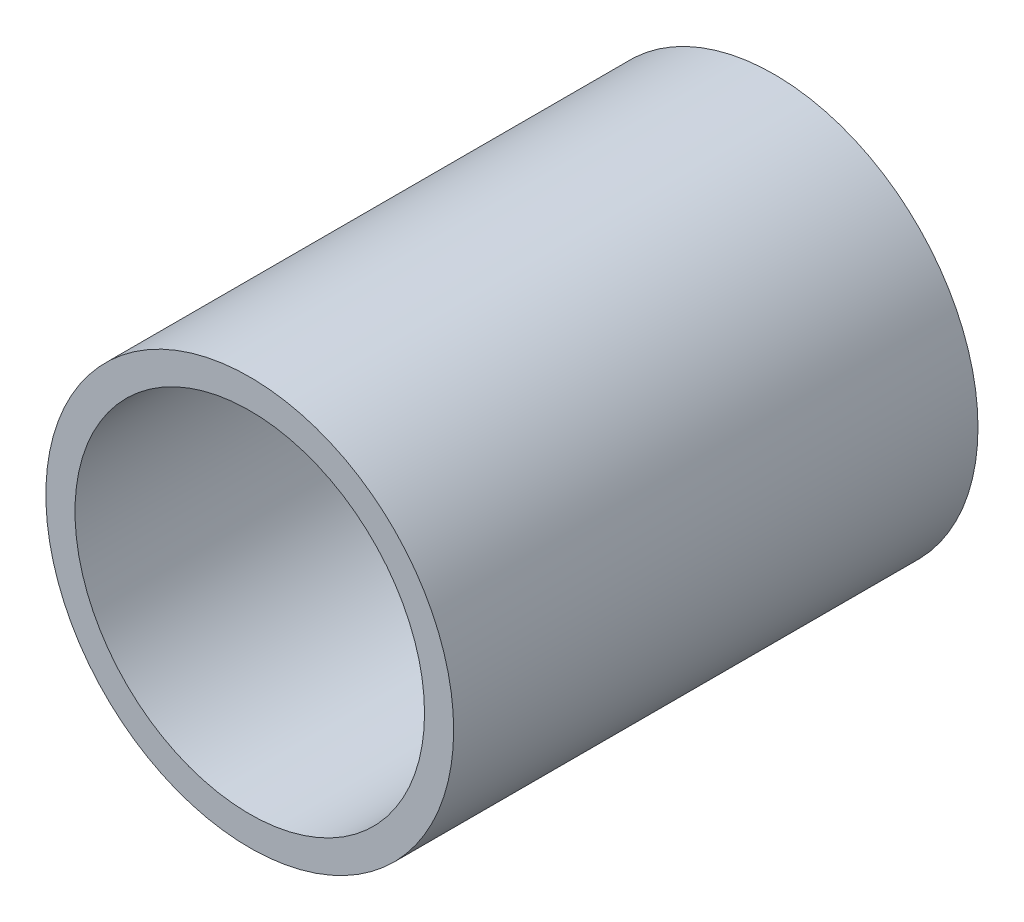
from build123d import *

# Parameters (mm, degrees)
SKETCH1_R           = 7
SKETCH1_R_2         = 6
BOSS_EXTRUDE1_DEPTH = 18


with BuildPart() as part:
    # Sketch1 → Boss-Extrude1 (new body)
    with BuildSketch(Plane.XY):
        Circle(SKETCH1_R)
        Circle(SKETCH1_R_2, mode=Mode.SUBTRACT)
    extrude(amount=BOSS_EXTRUDE1_DEPTH)


solid = part.part
